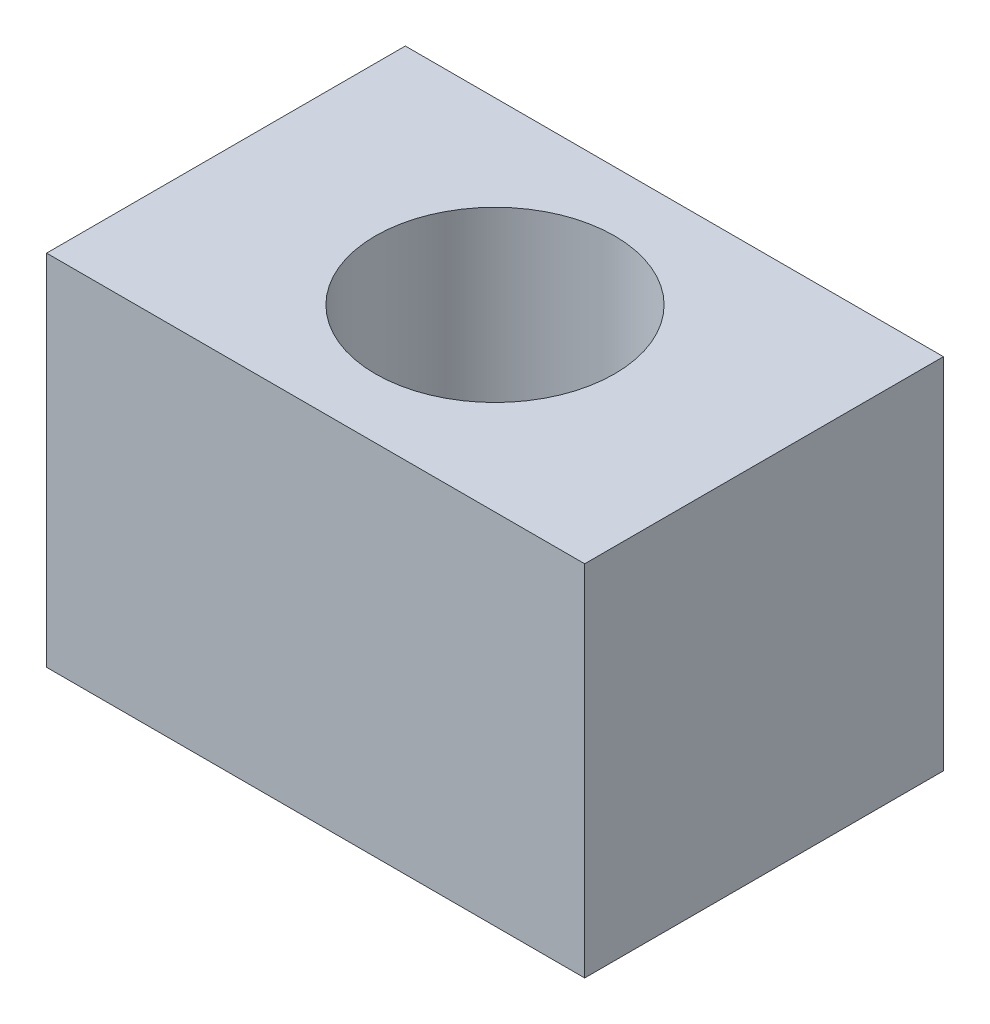
from build123d import *

# Parameters (mm, degrees)
ESQUISSE1_W        = 9
ESQUISSE1_H        = 6
ESQUISSE1_R        = 2
BOSS_EXTRU_1_DEPTH = 6


with BuildPart() as part:
    # Esquisse1 → Boss.-Extru.1 (new body)
    with BuildSketch(Plane(origin=(0, 0, 0), x_dir=(1, 0, 0), z_dir=(0, 1, 0))):
        Rectangle(ESQUISSE1_W, ESQUISSE1_H)
        Circle(ESQUISSE1_R, mode=Mode.SUBTRACT)
    extrude(amount=BOSS_EXTRU_1_DEPTH)


solid = part.part
